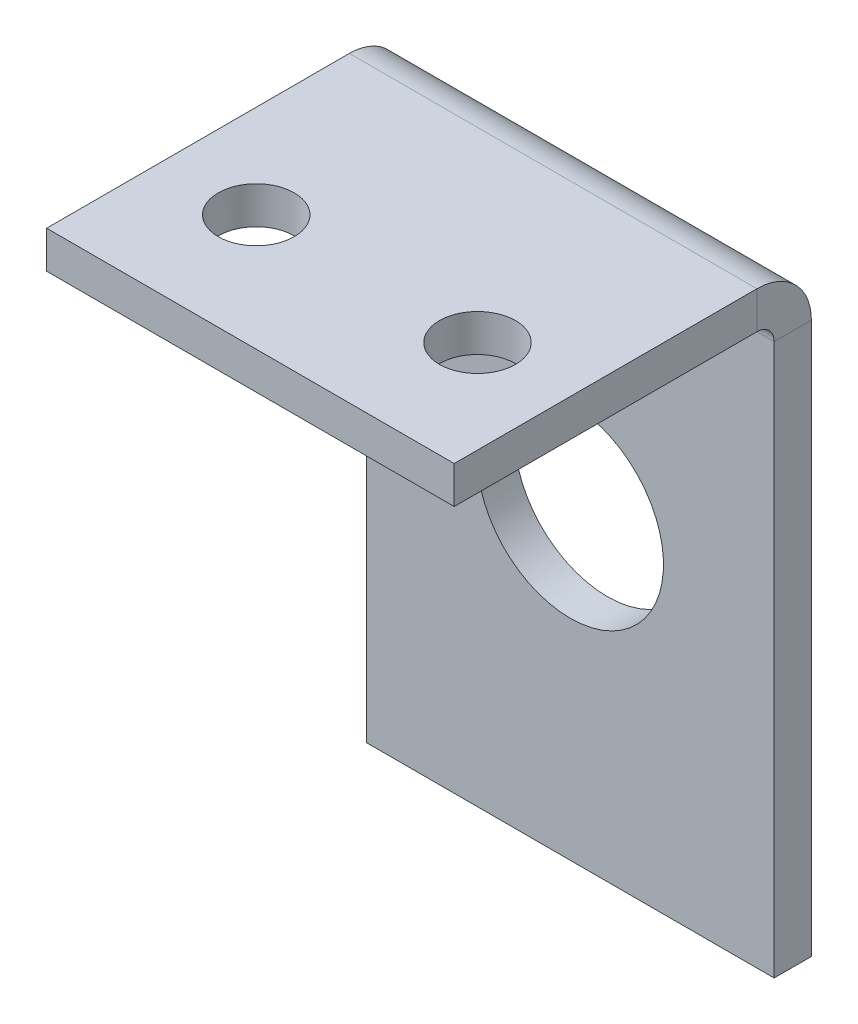
from build123d import *

# Parameters (mm, degrees)
SKETCH1_W                 = 17.5
SKETCH1_H                 = 10
BASE_FLANGE1_DEPTH        = 1.6
F_4_CLEARANCE_HOLE1_D     = 3.2639
F_4_CLEARANCE_HOLE1_DEPTH = 1.6
F_4_CLEARANCE_HOLE1_TIP   = 0.980574487
EDGE_FLANGE1_DEPTH        = 17.5
SKETCH20_R                = 4
CUT_EXTRUDE1_DEPTH        = 1.6


# Sheet-metal steps are written as plain solids
with BuildPart() as part:
    # Sketch1 → Base-Flange1 (new body)
    with BuildSketch(Plane(origin=(0, 0, 0), x_dir=(1, 0, 0), z_dir=(0, 1, 0))):
        with Locations((-14.536713287, 16.32983683)):
            Rectangle(SKETCH1_W, SKETCH1_H)
    extrude(amount=-BASE_FLANGE1_DEPTH)

    # #4 Clearance Hole1
    with Locations(Plane.XZ.offset(1.6)):
        with Locations((-9.786713287, -16.32983683), (-19.286713287, -16.32983683)):
            Hole(F_4_CLEARANCE_HOLE1_D / 2, depth=F_4_CLEARANCE_HOLE1_DEPTH)
            with Locations((0, 0, -(F_4_CLEARANCE_HOLE1_DEPTH + F_4_CLEARANCE_HOLE1_TIP / 2))):  # 118° drill point
                Cone(0, F_4_CLEARANCE_HOLE1_D / 2, F_4_CLEARANCE_HOLE1_TIP, mode=Mode.SUBTRACT)

    # Edge-Flange1 section (across the edge) → Edge-Flange1 (add)
    with BuildSketch(Plane(origin=(-23.286713287, -1.6, -25.06643683), x_dir=(0, 0, 1), z_dir=(1, 0, 0))):
        with BuildLine():
            Line((-1.6, 0.7366), (-1.6, 24.4))
            Line((-1.6, 24.4), (0, 24.4))
            Line((0, 24.4), (0, 0.7366))
            ThreePointArc((0, 0.7366), (0.215745145, 0.215745145), (0.7366, 0))
            Line((0.7366, 0), (3.7366, 0))
            Line((3.7366, 0), (3.7366, -1.6))
            Line((3.7366, -1.6), (0.7366, -1.6))
            ThreePointArc((0.7366, -1.6), (-0.915625705, -0.915625705), (-1.6, 0.7366))
        make_face()
    extrude(amount=EDGE_FLANGE1_DEPTH)

    # Sketch20 → Cut-Extrude1 (cut)
    with BuildSketch(Plane(origin=(0, 0, -26.66643683), x_dir=(-1, 0, 0), z_dir=(0, 0, -1))):
        with Locations(Location((14.536713287, -13, 0), (0, 0, 90))):
            Circle(SKETCH20_R)
    extrude(amount=-CUT_EXTRUDE1_DEPTH, mode=Mode.SUBTRACT)


solid = part.part
